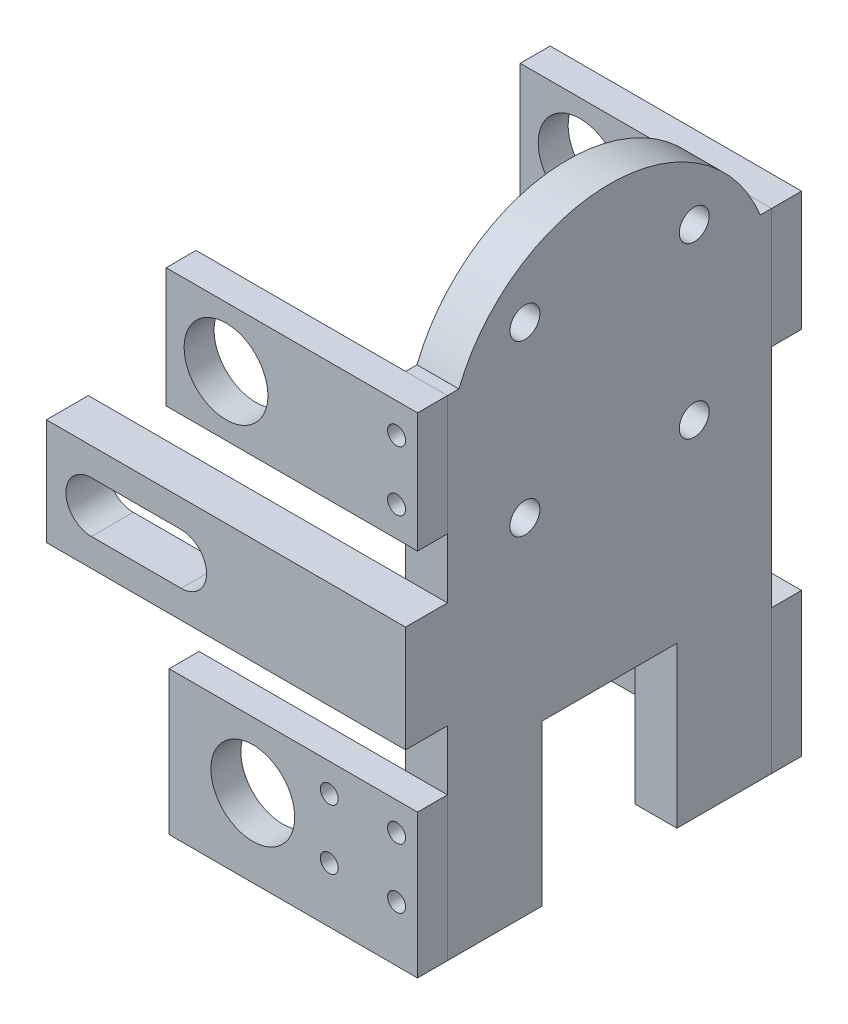
from build123d import *

# Parameters (mm, degrees)
BOSS_EXTRUDE1_DEPTH      = 3.5
BOSS_EXTRUDE1_DEPTH_BACK = 3.5
SKETCH2_R                = 2.5
CUT_EXTRUDE1_DEPTH       = 67.199141988
BOSS_EXTRUDE2_DEPTH      = 3.5
BOSS_EXTRUDE2_DEPTH_BACK = 3.5
SKETCH3_W                = 64.16
SKETCH3_H                = 20
SKETCH5_W                = 5
SKETCH5_H                = 20
BOSS_EXTRUDE4_DEPTH      = 35
SKETCH6_R                = 7
CUT_EXTRUDE2_DEPTH       = 96.910143363
SKETCH7_W                = 22.5
SKETCH7_H                = 15
CUT_EXTRUDE3_DEPTH       = 77.512263069
SKETCH8_W                = 41.5
SKETCH8_H                = 24
BOSS_EXTRUDE5_DEPTH      = 5
CUT_EXTRUDE4_DEPTH       = 101.663243043
CUT_EXTRUDE4_DEPTH_BACK  = 101.663243043
SKETCH9_R                = 7
SKETCH17_W               = 7
SKETCH17_H               = 15.83
BOSS_EXTRUDE8_DEPTH      = 11.77
SKETCH13_W               = 60
SKETCH13_H               = 17.77
BOSS_EXTRUDE7_DEPTH      = 7
CUT_EXTRUDE5_REACH       = 114.784
SKETCH16_R               = 1.5
CUT_EXTRUDE6_DEPTH       = 7.5
SPLIT1_START             = 27.08
SPLIT1_OUTLINE_W         = 41.5
SPLIT1_OUTLINE_H         = 24
SPLIT1_OUTLINE_R         = 1.5
SPLIT1_OUTLINE_R_2       = 7
SPLIT1_DEPTH             = 5
SPLIT1_2_OUTLINE_W       = 42
SPLIT1_2_OUTLINE_H       = 20
SPLIT1_2_OUTLINE_R       = 1.5
SPLIT1_2_OUTLINE_R_2     = 7
SPLIT1_2_DEPTH           = 5
SPLIT1_3_OUTLINE_W       = 41.5
SPLIT1_3_OUTLINE_H       = 24
SPLIT1_3_OUTLINE_R       = 7
SPLIT1_3_OUTLINE_R_2     = 1.5
SPLIT1_3_OUTLINE_W_2     = 42
SPLIT1_3_OUTLINE_H_2     = 20
SPLIT1_3_DEPTH           = 5


# Read off the part's stored shape, not the designer's step: Split1
with BuildPart() as part:
    # Sketch1 → Boss-Extrude1 (new, two sides: drawn at the far end of the back side and taken through both)
    with BuildSketch(Plane(origin=(0, 0, 0), x_dir=(0, 0, -1), z_dir=(1, 0, 0)).offset(-BOSS_EXTRUDE1_DEPTH_BACK)):
        with BuildLine():
            Line((-27.08, 0), (-27.08, -60))
            Line((-27.08, -60), (27.08, -60))
            Line((27.08, -60), (27.08, 0))
            ThreePointArc((27.08, 0), (0, 27.08), (-27.08, 0))
        make_face()
    extrude(amount=BOSS_EXTRUDE1_DEPTH + BOSS_EXTRUDE1_DEPTH_BACK)

    # Sketch2 → Cut-Extrude1 (cut, through all)
    with BuildSketch(Plane(origin=(3.5, 0, 0), x_dir=(0, 0, -1), z_dir=(1, 0, 0))):
        with Locations((-14.142135624, 14.142135624)):
            Circle(SKETCH2_R)
        with Locations((14.142135624, 14.142135624)):
            Circle(SKETCH2_R)
        with Locations((14.142135624, -14.142135624)):
            Circle(SKETCH2_R)
        with Locations((-14.142135624, -14.142135624)):
            Circle(SKETCH2_R)
    extrude(amount=-CUT_EXTRUDE1_DEPTH, mode=Mode.SUBTRACT)

    # Sketch3 → Boss-Extrude2 (add, two sides: drawn at the far end of the back side and taken through both)
    with BuildSketch(Plane(origin=(0, 0, 0), x_dir=(0, 0, -1), z_dir=(1, 0, 0)).offset(-BOSS_EXTRUDE2_DEPTH_BACK)):
        Rectangle(SKETCH3_W, SKETCH3_H)
    extrude(amount=BOSS_EXTRUDE2_DEPTH + BOSS_EXTRUDE2_DEPTH_BACK)

    # Sketch5 → Boss-Extrude4 (add)
    with BuildSketch(Plane.ZY.offset(3.5)):
        with Locations((-29.58, 0)):
            Rectangle(SKETCH5_W, SKETCH5_H)
        with Locations((29.58, 0)):
            Rectangle(SKETCH5_W, SKETCH5_H)
    extrude(amount=BOSS_EXTRUDE4_DEPTH)

    # Sketch6 → Cut-Extrude2 (cut, through all)
    with BuildSketch(Plane(origin=(0, 0, -32.08), x_dir=(-1, 0, 0), z_dir=(0, 0, -1))):
        with Locations((28.5, 0)):
            Circle(SKETCH6_R)
    extrude(amount=-CUT_EXTRUDE2_DEPTH, mode=Mode.SUBTRACT)

    # Sketch7 → Cut-Extrude3 (cut, through all)
    with BuildSketch(Plane.ZY.offset(3.5)):
        with Locations((0, -52.5)):
            Rectangle(SKETCH7_W, SKETCH7_H)
    extrude(amount=-CUT_EXTRUDE3_DEPTH, mode=Mode.SUBTRACT)

    # Sketch8 → Boss-Extrude5 (add)
    with BuildSketch(Plane.XY.offset(27.08)):
        with Locations((-17.25, -59.77)):
            Rectangle(SKETCH8_W, SKETCH8_H)
    boss_extrude5 = extrude(amount=BOSS_EXTRUDE5_DEPTH)

    # Mirror1: Boss-Extrude5 across plane
    add(boss_extrude5.mirror(Plane.XY))

    # Sketch9 → Cut-Extrude4 (cut, two sides: drawn at the far end of the back side and taken through both)
    with BuildSketch(Plane(origin=(0, 0, 27.08), x_dir=(-1, 0, 0), z_dir=(0, 0, -1)).offset(-CUT_EXTRUDE4_DEPTH_BACK)):
        with Locations((24.02, -58.77)):
            Circle(SKETCH9_R)
    extrude(amount=CUT_EXTRUDE4_DEPTH + CUT_EXTRUDE4_DEPTH_BACK, mode=Mode.SUBTRACT)

    # Sketch17 → Boss-Extrude8 (add)
    with BuildSketch(Plane.XZ.offset(60)):
        with Locations((0, 19.165)):
            Rectangle(SKETCH17_W, SKETCH17_H)
        with Locations((0, -19.165)):
            Rectangle(SKETCH17_W, SKETCH17_H)
    extrude(amount=BOSS_EXTRUDE8_DEPTH)

    # Sketch13 → Boss-Extrude7 (add)
    with BuildSketch(Plane.XY.offset(27.08)):
        with Locations((-26.5, -28.885)):
            Rectangle(SKETCH13_W, SKETCH13_H)
    extrude(amount=BOSS_EXTRUDE7_DEPTH)

    # Sketch15 → Cut-Extrude5 (cut, up to next)
    with BuildSketch(Plane.XY.offset(34.08), mode=Mode.PRIVATE) as cut_extrude5_sk1:
        with BuildLine():
            Line((-34, -33.135), (-49, -33.135))
            ThreePointArc((-49, -33.135), (-53.25, -28.885), (-49, -24.635))
            Line((-49, -24.635), (-34, -24.635))
            ThreePointArc((-34, -24.635), (-29.75, -28.885), (-34, -33.135))
        make_face()
    cut_extrude5_tool1 = extrude(cut_extrude5_sk1.sketch, amount=-CUT_EXTRUDE5_REACH, mode=Mode.PRIVATE) & part.part
    add(cut_extrude5_tool1.solids().sort_by_distance((-41.5, -28.885, 34.08))[0], mode=Mode.SUBTRACT)

    # Sketch16 → Cut-Extrude6 (cut, symmetric)
    with BuildSketch(Plane.XY.offset(32.08)):
        with Locations((0, 5)):
            Circle(SKETCH16_R)
        with Locations((0, -5)):
            Circle(SKETCH16_R)
        with Locations((0, -52.5)):
            Circle(SKETCH16_R)
        with Locations((0, -62.5)):
            Circle(SKETCH16_R)
        with Locations((-11.25, -52.5)):
            Circle(SKETCH16_R)
        with Locations((-11.25, -62.5)):
            Circle(SKETCH16_R)
    cut_extrude6 = extrude(amount=CUT_EXTRUDE6_DEPTH, both=True, mode=Mode.SUBTRACT)

    # Mirror3: Cut-Extrude6 across plane
    add(cut_extrude6.mirror(Plane.XY), mode=Mode.SUBTRACT)

    # Split1 3 outline → Split1 3 (cut)
    # profile 1 of 2: a face of its own
    with BuildSketch(Plane.XY.offset(SPLIT1_START)):
        with Locations((-17.25, -59.77)):
            Rectangle(SPLIT1_3_OUTLINE_W, SPLIT1_3_OUTLINE_H)
        with Locations((-24.02, -58.77)):
            Circle(SPLIT1_3_OUTLINE_R, mode=Mode.SUBTRACT)
        with Locations((-11.25, -62.5)):
            Circle(SPLIT1_3_OUTLINE_R_2, mode=Mode.SUBTRACT)
        with Locations((-11.25, -52.5)):
            Circle(SPLIT1_3_OUTLINE_R_2, mode=Mode.SUBTRACT)
        with Locations((0, -62.5)):
            Circle(SPLIT1_3_OUTLINE_R_2, mode=Mode.SUBTRACT)
        with Locations((0, -52.5)):
            Circle(SPLIT1_3_OUTLINE_R_2, mode=Mode.SUBTRACT)
    # profile 2 of 2: a face of its own
    with BuildSketch(Plane.XY.offset(SPLIT1_START)):
        with Locations((-17.5, 0)):
            Rectangle(SPLIT1_3_OUTLINE_W_2, SPLIT1_3_OUTLINE_H_2)
        with Locations((-28.5, 0)):
            Circle(SPLIT1_3_OUTLINE_R, mode=Mode.SUBTRACT)
        with Locations((0, -5)):
            Circle(SPLIT1_3_OUTLINE_R_2, mode=Mode.SUBTRACT)
        with Locations((0, 5)):
            Circle(SPLIT1_3_OUTLINE_R_2, mode=Mode.SUBTRACT)
    extrude(amount=SPLIT1_3_DEPTH, mode=Mode.SUBTRACT)


with BuildPart() as body_2:
    # Split1 outline → Split1 (new body)
    with BuildSketch(Plane.XY.offset(SPLIT1_START)):
        with Locations((-17.25, -59.77)):
            Rectangle(SPLIT1_OUTLINE_W, SPLIT1_OUTLINE_H)
        with Locations((-11.25, -62.5)):
            Circle(SPLIT1_OUTLINE_R, mode=Mode.SUBTRACT)
        with Locations((0, -62.5)):
            Circle(SPLIT1_OUTLINE_R, mode=Mode.SUBTRACT)
        with Locations((-24.02, -58.77)):
            Circle(SPLIT1_OUTLINE_R_2, mode=Mode.SUBTRACT)
        with Locations((-11.25, -52.5)):
            Circle(SPLIT1_OUTLINE_R, mode=Mode.SUBTRACT)
        with Locations((0, -52.5)):
            Circle(SPLIT1_OUTLINE_R, mode=Mode.SUBTRACT)
    extrude(amount=SPLIT1_DEPTH)


with BuildPart() as body_3:
    # Split1 2 outline → Split1 2 (new body)
    with BuildSketch(Plane.XY.offset(SPLIT1_START)):
        with Locations((-17.5, 0)):
            Rectangle(SPLIT1_2_OUTLINE_W, SPLIT1_2_OUTLINE_H)
        with Locations((0, -5)):
            Circle(SPLIT1_2_OUTLINE_R, mode=Mode.SUBTRACT)
        with Locations((-28.5, 0)):
            Circle(SPLIT1_2_OUTLINE_R_2, mode=Mode.SUBTRACT)
        with Locations((0, 5)):
            Circle(SPLIT1_2_OUTLINE_R, mode=Mode.SUBTRACT)
    extrude(amount=SPLIT1_2_DEPTH)


with BuildPart() as body_4:
    # Split2: the piece on the far side of the plane
    add(part.part)
    split(bisect_by=Plane(origin=(0, 0, -27.08), x_dir=(0, -1, 0), z_dir=(0, 0, -1)), keep=Keep.BOTTOM)


with BuildPart() as part_1:
    add(part.part)

    # Split2
    split(bisect_by=Plane(origin=(0, 0, -27.08), x_dir=(0, -1, 0), z_dir=(0, 0, -1)), keep=Keep.TOP)


solid = Compound([body_2.part, body_3.part, body_4.part, part_1.part])
